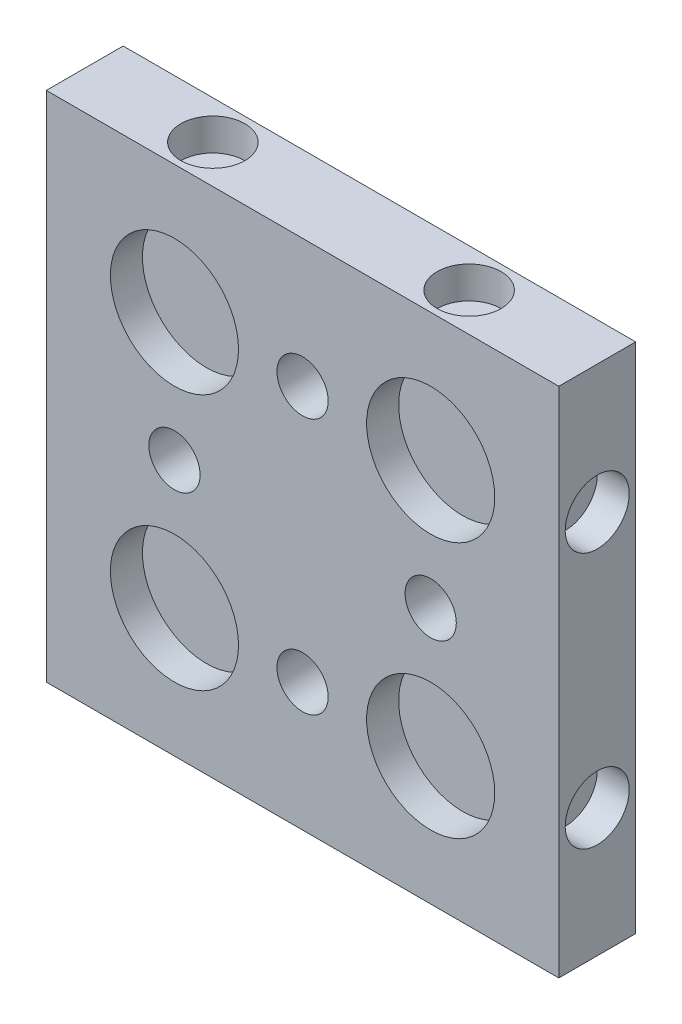
from build123d import *

# Parameters (mm, degrees)
SKETCH1_W           = 50.8
SKETCH1_H           = 50.8
BOSS_EXTRUDE1_DEPTH = 7.62
SKETCH3_R           = 2.54
CUT_EXTRUDE1_DEPTH  = 40.985491746
SKETCH4_R           = 6.35
CUT_EXTRUDE2_DEPTH  = 3.175
SKETCH5_R           = 3.175
CUT_EXTRUDE3_DEPTH  = 3.175
SKETCH6_R           = 3.175
CUT_EXTRUDE4_DEPTH  = 3.175
CUT_EXTRUDE5_START  = -3.175
SKETCH7_R           = 3.175
CUT_EXTRUDE5_DEPTH  = 3.175
CUT_EXTRUDE6_START  = -3.175
SKETCH8_R           = 3.175
CUT_EXTRUDE6_DEPTH  = 3.175


with BuildPart() as part:
    # Sketch1 → Boss-Extrude1 (new body)
    with BuildSketch(Plane.XY):
        with Locations((4.049275362, 0.552173913)):
            Rectangle(SKETCH1_W, SKETCH1_H)
    extrude(amount=BOSS_EXTRUDE1_DEPTH)

    # Sketch3 → Cut-Extrude1 (cut, through all)
    with BuildSketch(Plane.XY.offset(7.62)):
        with Locations((-8.650724638, 0.552173913)):
            Circle(SKETCH3_R)
        with Locations((4.049275362, 13.252173913)):
            Circle(SKETCH3_R)
        with Locations((4.049275362, -12.147826087)):
            Circle(SKETCH3_R)
        with Locations((16.749275362, 0.552173913)):
            Circle(SKETCH3_R)
    extrude(amount=-CUT_EXTRUDE1_DEPTH, mode=Mode.SUBTRACT)

    # Sketch4 → Cut-Extrude2 (cut)
    with BuildSketch(Plane.XY.offset(7.62)):
        with Locations((-8.650724638, 13.252173913)):
            Circle(SKETCH4_R)
        with Locations((16.749275362, 13.252173913)):
            Circle(SKETCH4_R)
        with Locations((16.749275362, -12.147826087)):
            Circle(SKETCH4_R)
        with Locations((-8.650724638, -12.147826087)):
            Circle(SKETCH4_R)
    extrude(amount=-CUT_EXTRUDE2_DEPTH, mode=Mode.SUBTRACT)

    # Sketch5 → Cut-Extrude3 (cut)
    with BuildSketch(Plane(origin=(29.449275362, 0, 0), x_dir=(0, 0, -1), z_dir=(1, 0, 0))):
        with Locations((-3.81, 13.252173913)):
            Circle(SKETCH5_R)
        with Locations((-3.81, -12.147826087)):
            Circle(SKETCH5_R)
    extrude(amount=-CUT_EXTRUDE3_DEPTH, mode=Mode.SUBTRACT)

    # Sketch6 → Cut-Extrude4 (cut)
    with BuildSketch(Plane(origin=(0, -24.847826087, 0), x_dir=(-1, 0, 0), z_dir=(0, -1, 0))):
        with Locations((8.650724638, -3.81)):
            Circle(SKETCH6_R)
        with Locations((-16.749275362, -3.81)):
            Circle(SKETCH6_R)
    extrude(amount=-CUT_EXTRUDE4_DEPTH, mode=Mode.SUBTRACT)

    # Sketch7 → Cut-Extrude5 (cut)
    with BuildSketch(Plane.ZY.offset(21.350724638).offset(CUT_EXTRUDE5_START)):
        with Locations((3.81, 13.252173913)):
            Circle(SKETCH7_R)
        with Locations((3.81, -12.147826087)):
            Circle(SKETCH7_R)
    extrude(amount=CUT_EXTRUDE5_DEPTH, mode=Mode.SUBTRACT)

    # Sketch8 → Cut-Extrude6 (cut)
    with BuildSketch(Plane(origin=(0, 25.952173913, 0), x_dir=(1, 0, 0), z_dir=(0, 1, 0)).offset(CUT_EXTRUDE6_START)):
        with Locations((-8.650724638, -3.81)):
            Circle(SKETCH8_R)
        with Locations((16.749275362, -3.81)):
            Circle(SKETCH8_R)
    extrude(amount=CUT_EXTRUDE6_DEPTH, mode=Mode.SUBTRACT)


solid = part.part
